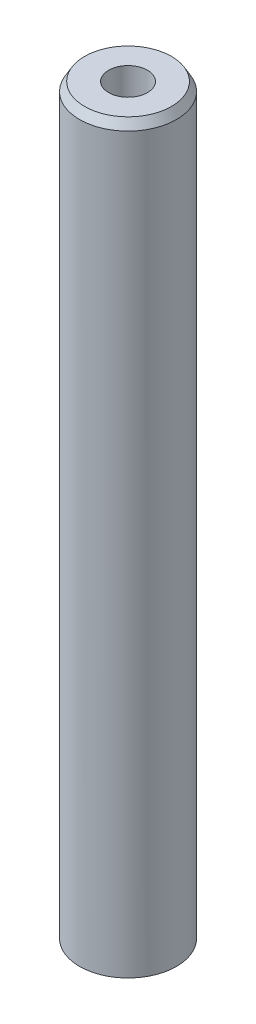
from build123d import *
from OCP.BRepFilletAPI import BRepFilletAPI_MakeChamfer

# Parameters (mm, degrees)
SKETCH1_R           = 5
BOSS_EXTRUDE1_DEPTH = 77.064836117
SKETCH2_R           = 2.003256886
CUT_EXTRUDE1_DEPTH  = 78.388558364
CHAMFER1_SIZE       = 0.905639576
CHAMFER1_SIZE2      = 0.522871253


with BuildPart() as part:
    # Sketch1 → Boss-Extrude1 (new body)
    with BuildSketch(Plane(origin=(0, 0, 0), x_dir=(1, 0, 0), z_dir=(0, 1, 0))):
        Circle(SKETCH1_R)
    extrude(amount=BOSS_EXTRUDE1_DEPTH)

    # Sketch2 → Cut-Extrude1 (cut, through all)
    with BuildSketch(Plane(origin=(0, 0, 0), x_dir=(1, 0, 0), z_dir=(0, 1, 0))):
        Circle(SKETCH2_R)
    extrude(amount=CUT_EXTRUDE1_DEPTH, mode=Mode.SUBTRACT)

    # Chamfer1: one chamfer whose edges measure the first distance from different faces: ONE call of the kernel's chamfer builder (chamfer() names one face for all edges)
    chamfer1_edges_1 = [part.edges().sort_by_distance(p)[0] for p in [
        (-5, 77.064836117, 0),
    ]]
    chamfer1_side_1 = [part.faces().sort_by_distance(p)[0] for p in [
        (-5, 38.532418058, 0),
    ]]
    chamfer1_edges_2 = [part.edges().sort_by_distance(p)[0] for p in [
        (-5, 0, 0),
    ]]
    chamfer1_side_2 = [part.faces().sort_by_distance(p)[0] for p in [
        (-4.858578644, 0, 0),
    ]]
    chamfer1 = BRepFilletAPI_MakeChamfer(part.part.solid().wrapped)
    for e in chamfer1_edges_1:
        chamfer1.Add(CHAMFER1_SIZE, CHAMFER1_SIZE2, e.wrapped, chamfer1_side_1[0].wrapped)  # the first distance lies on this face
    for e in chamfer1_edges_2:
        chamfer1.Add(CHAMFER1_SIZE, CHAMFER1_SIZE2, e.wrapped, chamfer1_side_2[0].wrapped)  # the first distance lies on this face
    add(Compound.cast(chamfer1.Shape()), mode=Mode.REPLACE)


solid = part.part
